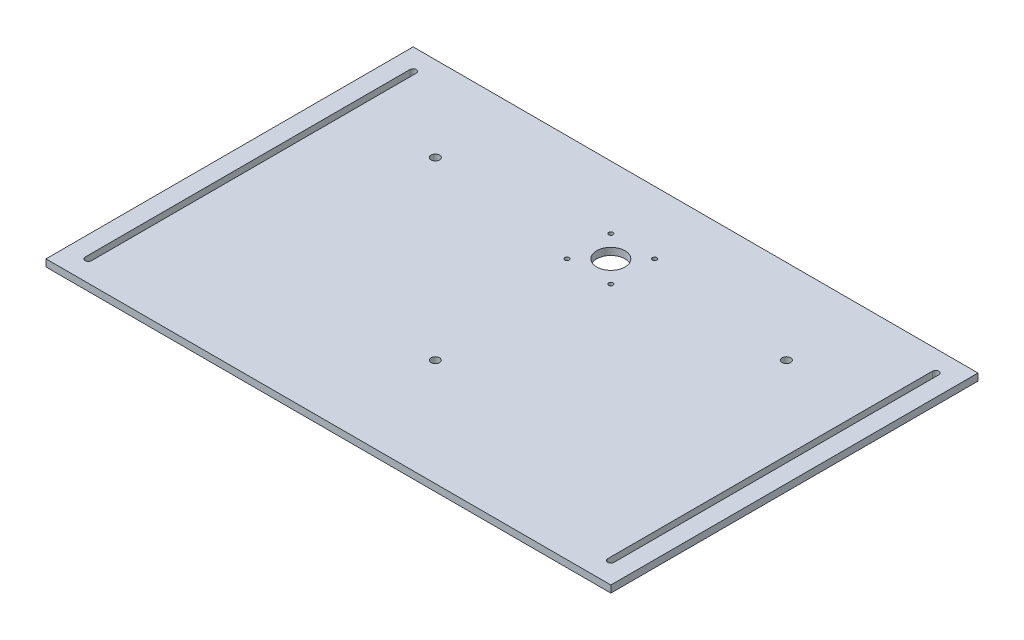
from build123d import *

# Parameters (mm, degrees)
SKETCH_1_W          = 400
SKETCH_1_H          = 260
EXTRUDE_1_DEPTH     = 5
CUT_EXTRUDE_1_DEPTH = 239.589605809
SKETCH_3_R          = 1.55
SKETCH_3_R_2        = 10
SKETCH_3_R_3        = 3
CUT_EXTRUDE_2_DEPTH = 239.589605809


with BuildPart() as part:
    # 草圖1 → 填料-伸長1 (new body)
    with BuildSketch(Plane(origin=(0, 0, 0), x_dir=(1, 0, 0), z_dir=(0, 1, 0))):
        Rectangle(SKETCH_1_W, SKETCH_1_H)
    extrude(amount=EXTRUDE_1_DEPTH)

    # 草圖2 → 除料-伸長1 (cut, through all)
    with BuildSketch(Plane(origin=(0, 5, 0), x_dir=(1, 0, 0), z_dir=(0, 1, 0))):
        with BuildLine():
            Line((-182.75, 115), (-182.75, -115))
            ThreePointArc((-182.75, -115), (-185, -117.25), (-187.25, -115))
            Line((-187.25, -115), (-187.25, 115))
            ThreePointArc((-187.25, 115), (-185, 117.25), (-182.75, 115))
        make_face()
        with BuildLine():
            Line((182.75, 115), (182.75, -115))
            ThreePointArc((182.75, -115), (185, -117.25), (187.25, -115))
            Line((187.25, -115), (187.25, 115))
            ThreePointArc((187.25, 115), (185, 117.25), (182.75, 115))
        make_face()
    extrude(amount=-CUT_EXTRUDE_1_DEPTH, mode=Mode.SUBTRACT)

    # 草圖3 → 除料-伸長2 (cut, through all)
    with BuildSketch(Plane(origin=(0, 5, 0), x_dir=(1, 0, 0), z_dir=(0, 1, 0))):
        with Locations((-15.5, 85.5)):
            Circle(SKETCH_3_R)
        with Locations((15.5, 85.5)):
            Circle(SKETCH_3_R)
        with Locations((-15.5, 54.5)):
            Circle(SKETCH_3_R)
        with Locations((15.5, 54.5)):
            Circle(SKETCH_3_R)
        with Locations((0, 70)):
            Circle(SKETCH_3_R_2)
        with Locations((-124.304765272, 70)):
            Circle(SKETCH_3_R_3)
        with Locations((124.304765272, 70)):
            Circle(SKETCH_3_R_3)
        with Locations((0, -54.304765272)):
            Circle(SKETCH_3_R_3)
    extrude(amount=-CUT_EXTRUDE_2_DEPTH, mode=Mode.SUBTRACT)


solid = part.part
